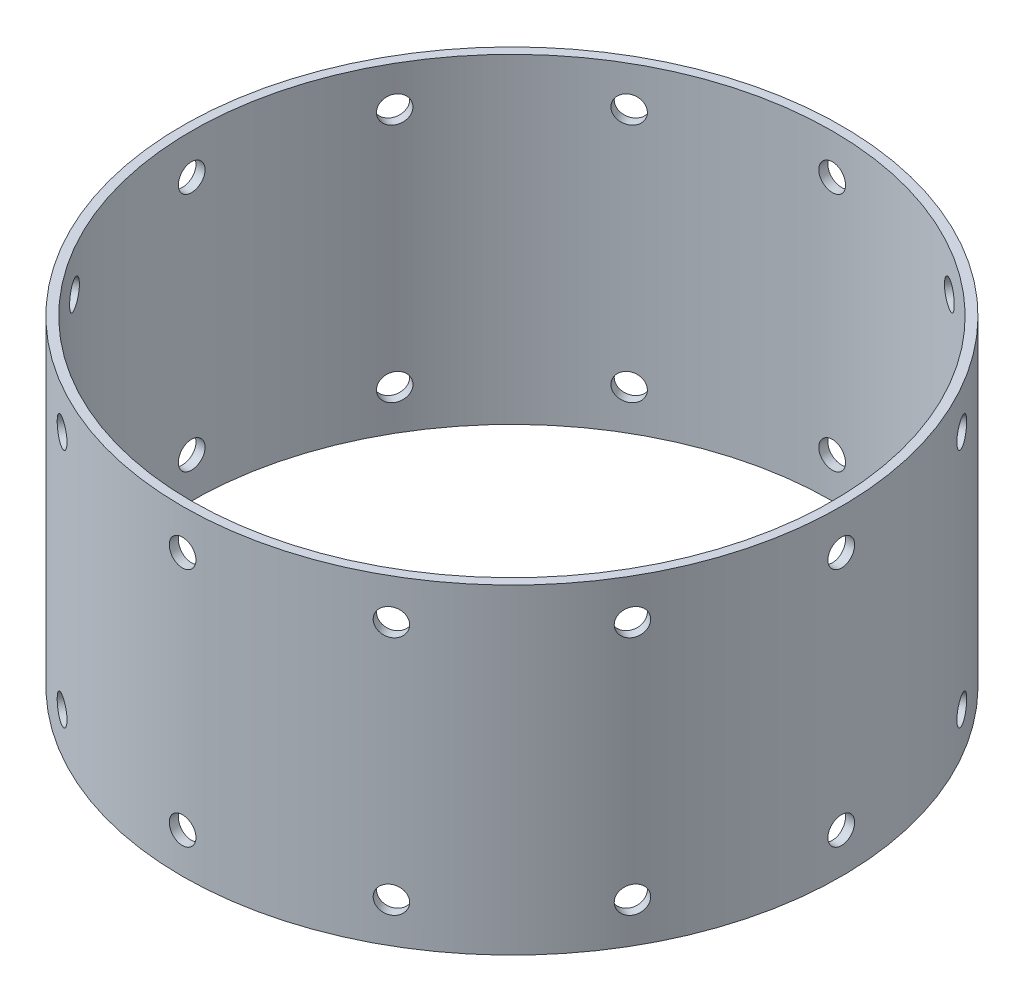
from build123d import *

# Parameters (mm, degrees)
SKETCH1_R           = 78.359
SKETCH1_R_2         = 76.2
BOSS_EXTRUDE1_DEPTH = 76.2
SKETCH2_R           = 3.175
CUT_EXTRUDE1_DEPTH  = 135.486823749
CIRPATTERN1_COUNT   = 12


with BuildPart() as part:
    # Sketch1 → Boss-Extrude1 (new body)
    with BuildSketch(Plane(origin=(0, 0, 0), x_dir=(1, 0, 0), z_dir=(0, 1, 0))):
        Circle(SKETCH1_R)
        Circle(SKETCH1_R_2, mode=Mode.SUBTRACT)
    extrude(amount=BOSS_EXTRUDE1_DEPTH)

    # Sketch2 → Cut-Extrude1 (cut, through all)
    with BuildSketch(Plane.XY):
        with Locations((0, 9.525)):
            Circle(SKETCH2_R)
        with Locations((0, 66.675)):
            Circle(SKETCH2_R)
    cut_extrude1 = extrude(amount=-CUT_EXTRUDE1_DEPTH, mode=Mode.SUBTRACT)

    # CirPattern1: Cut-Extrude1 ×12 about axis
    cirpattern1_axis = Axis((0, 0, 0), (0, 1, 0))
    for i in range(1, CIRPATTERN1_COUNT):
        add(cut_extrude1.rotate(cirpattern1_axis, i * 360 / CIRPATTERN1_COUNT), mode=Mode.SUBTRACT)


solid = part.part
